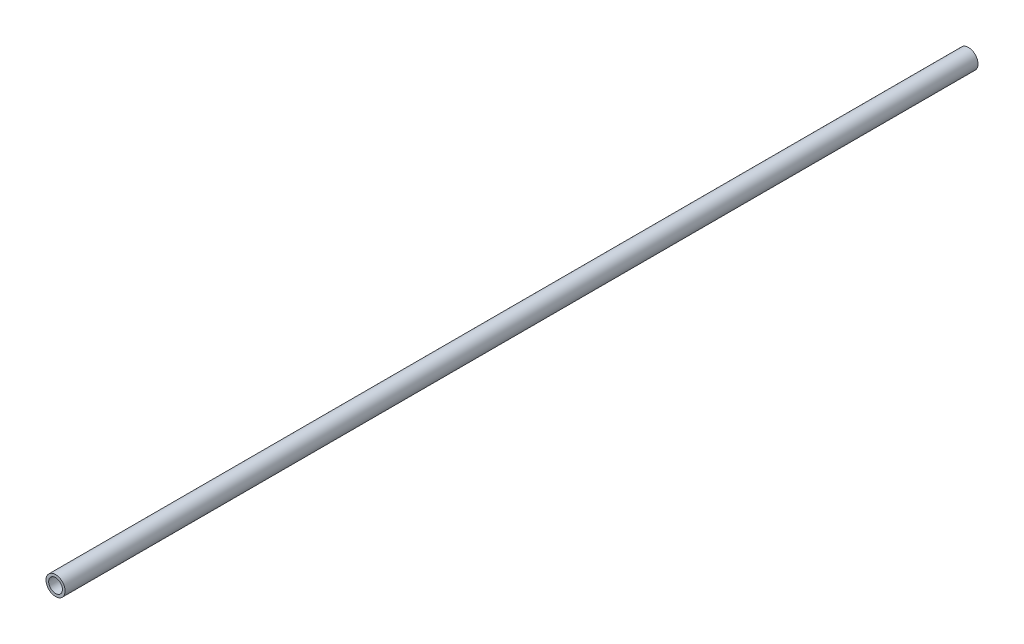
from build123d import *

# Parameters (mm, degrees)
SKETCH1_R           = 2.425
SKETCH1_R_2         = 1.75
BOSS_EXTRUDE1_DEPTH = 232


with BuildPart() as part:
    # Sketch1 → Boss-Extrude1 (new body)
    with BuildSketch(Plane.XY):
        Circle(SKETCH1_R)
        Circle(SKETCH1_R_2, mode=Mode.SUBTRACT)
    extrude(amount=BOSS_EXTRUDE1_DEPTH)


solid = part.part
